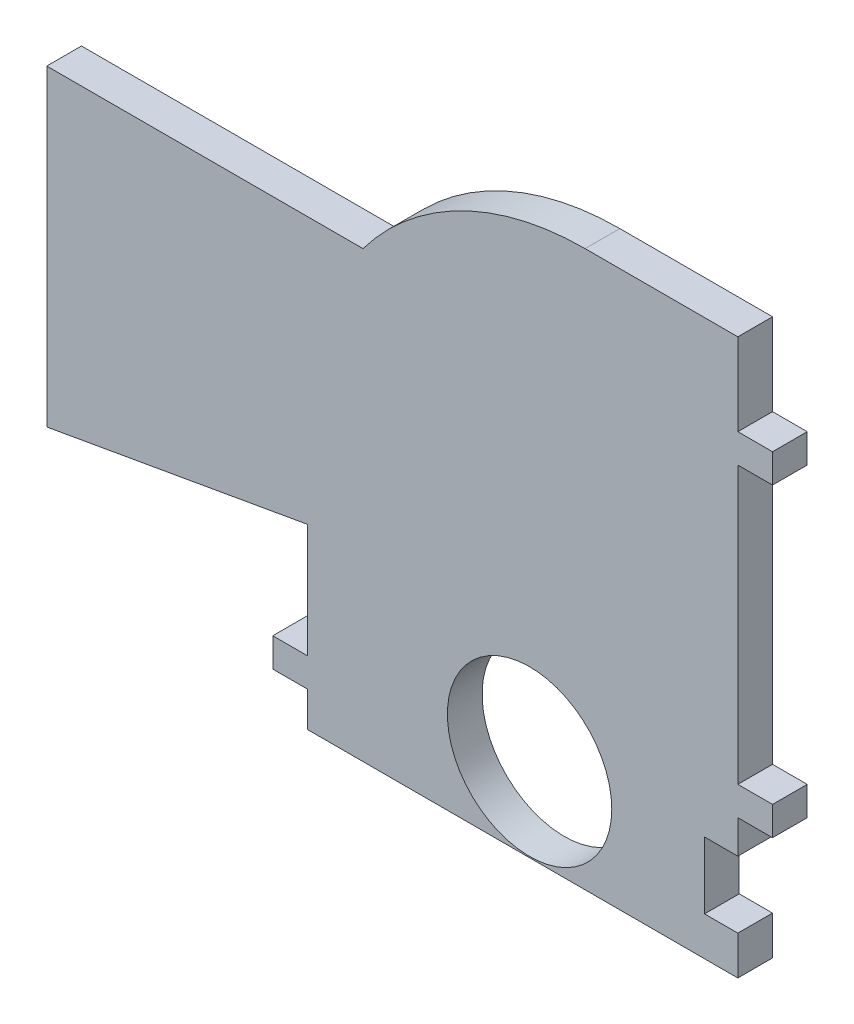
from build123d import *

# Parameters (mm, degrees)
SKETCH1_R           = 3.7592
BOSS_EXTRUDE1_DEPTH = 1.5875


with BuildPart() as part:
    # Sketch1 → Boss-Extrude1 (new body)
    with BuildSketch(Plane.XY):
        with BuildLine():
            Line((-22.084921519, 2.212007412), (-10.16, 4.318))
            Line((-10.16, 4.318), (-10.16, -0.889))
            Line((-10.16, -0.889), (-11.7475, -0.889))
            Line((-11.7475, -0.889), (-11.7475, -2.2098))
            Line((-11.7475, -2.2098), (-10.16, -2.2098))
            Line((-10.16, -2.2098), (-10.16, -3.81))
            Line((-10.16, -3.81), (9.525, -3.81))
            Line((9.525, -3.81), (9.525, -2.032))
            Line((9.525, -2.032), (8.001, -2.032))
            Line((8.001, -2.032), (8.001, 1.016))
            Line((8.001, 1.016), (9.525, 1.016))
            Line((9.525, 1.016), (9.525, 2.54))
            Line((9.525, 2.54), (11.1125, 2.54))
            Line((11.1125, 2.54), (11.1125, 3.8608))
            Line((11.1125, 3.8608), (9.525, 3.8608))
            Line((9.525, 3.8608), (9.525, 16.51))
            Line((9.525, 16.51), (11.1125, 16.51))
            Line((11.1125, 16.51), (11.1125, 17.8308))
            Line((11.1125, 17.8308), (9.525, 17.8308))
            Line((9.525, 17.8308), (9.525, 21.59))
            Line((9.525, 21.59), (2.54, 21.59))
            ThreePointArc((2.54, 21.59), (-3.139612663, 20.249225326), (-7.62, 16.51))
            Line((-7.62, 16.51), (-22.084921519, 16.51))
            Line((-22.084921519, 16.51), (-22.084921519, 2.212007412))
        make_face()
        Circle(SKETCH1_R, mode=Mode.SUBTRACT)
    extrude(amount=BOSS_EXTRUDE1_DEPTH)


solid = part.part
